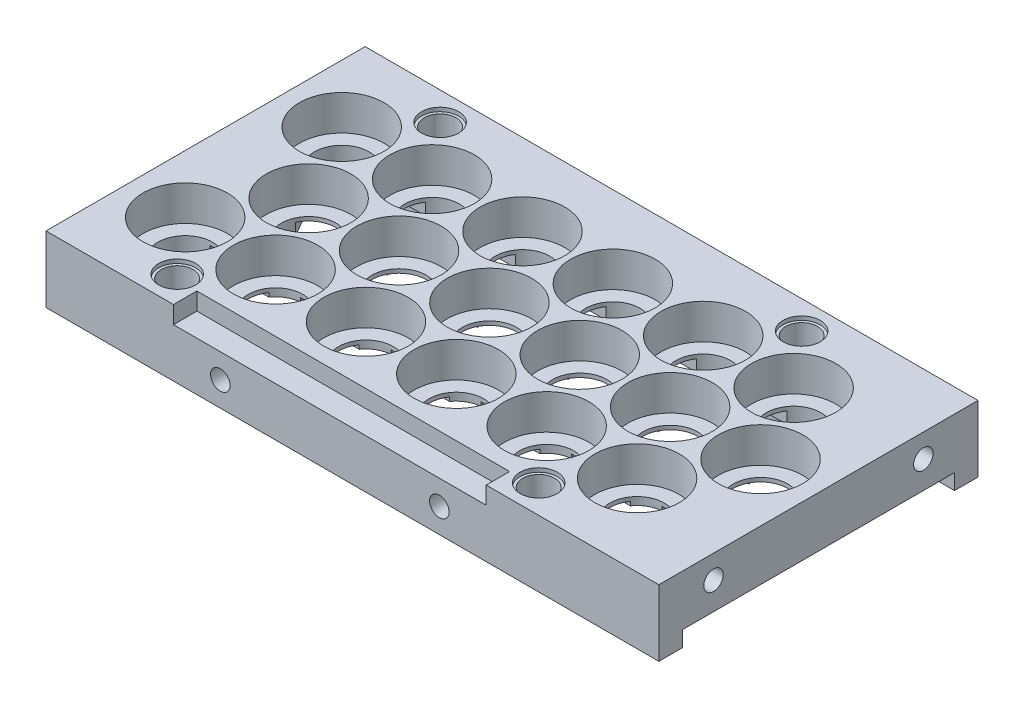
from build123d import *
from build123d.topology import SkipClean

# Parameters (mm, degrees)
SKETCH1_W            = 156.975
SKETCH1_H            = 81.746976195
SKETCH1_R            = 10.825
BOSS_EXTRUDE2_DEPTH  = 11
SKETCH1_3_R          = 10.825
SKETCH1_3_R_2        = 7
BOSS_EXTRUDE3_DEPTH  = 2
CUT_EXTRUDE1_DEPTH   = 1
CUT_EXTRUDE3_REACH   = 157.046
SKETCH9_R            = 4.0767
SKETCH10_R           = 4.7625
CUT_EXTRUDE4_DEPTH   = 1
SKETCH13_R           = 6.5
BOSS_EXTRUDE7_DEPTH  = 6
BOSS_EXTRUDE9_START  = 2
BOSS_EXTRUDE9_DEPTH  = 2
BOSS_EXTRUDE10_DEPTH = 2
SKETCH17_R           = 2.5
CUT_EXTRUDE5_DEPTH   = 4
SKETCH19_W           = 80.1
SKETCH19_H           = 4.475
CUT_EXTRUDE6_DEPTH   = 6
SKETCH20_R           = 2.5
CUT_EXTRUDE7_DEPTH   = 5
SKETCH22_R           = 2.5
CUT_EXTRUDE8_DEPTH   = 10


with BuildPart() as part:
    # Sketch1 → Boss-Extrude2 (new body)
    with BuildSketch(Plane(origin=(0, 0, 0), x_dir=(1, 0, 0), z_dir=(0, 1, 0))):
        with Locations((63.6625, -20.048488098)):
            Rectangle(SKETCH1_W, SKETCH1_H)
        with Locations((0, -40.096976195)):
            Circle(SKETCH1_R, mode=Mode.SUBTRACT)
        with Locations((23.15, -40.096976195)):
            Circle(SKETCH1_R, mode=Mode.SUBTRACT)
        with Locations((46.3, -40.096976195)):
            Circle(SKETCH1_R, mode=Mode.SUBTRACT)
        with Locations((69.45, -40.096976195)):
            Circle(SKETCH1_R, mode=Mode.SUBTRACT)
        with Locations((92.6, -40.096976195)):
            Circle(SKETCH1_R, mode=Mode.SUBTRACT)
        with Locations((115.75, -40.096976195)):
            Circle(SKETCH1_R, mode=Mode.SUBTRACT)
        with Locations((11.575, -20.048488098)):
            Circle(SKETCH1_R, mode=Mode.SUBTRACT)
        Circle(SKETCH1_R, mode=Mode.SUBTRACT)
        with Locations((23.15, 0)):
            Circle(SKETCH1_R, mode=Mode.SUBTRACT)
        with Locations((34.725, -20.048488098)):
            Circle(SKETCH1_R, mode=Mode.SUBTRACT)
        with Locations((57.875, -20.048488098)):
            Circle(SKETCH1_R, mode=Mode.SUBTRACT)
        with Locations((46.3, 0)):
            Circle(SKETCH1_R, mode=Mode.SUBTRACT)
        with Locations((81.025, -20.048488098)):
            Circle(SKETCH1_R, mode=Mode.SUBTRACT)
        with Locations((69.45, 0)):
            Circle(SKETCH1_R, mode=Mode.SUBTRACT)
        with Locations((92.6, 0)):
            Circle(SKETCH1_R, mode=Mode.SUBTRACT)
        with Locations((104.175, -20.048488098)):
            Circle(SKETCH1_R, mode=Mode.SUBTRACT)
        with Locations((127.325, -20.048488098)):
            Circle(SKETCH1_R, mode=Mode.SUBTRACT)
        with Locations((115.75, 0)):
            Circle(SKETCH1_R, mode=Mode.SUBTRACT)
    extrude(amount=BOSS_EXTRUDE2_DEPTH)

    # Sketch1<3> → Boss-Extrude3 (add)
    # profile 1 of 18: a face of its own
    with BuildSketch(Plane(origin=(0, 0, 0), x_dir=(1, 0, 0), z_dir=(0, 1, 0))):
        Circle(SKETCH1_3_R)
        Circle(SKETCH1_3_R_2, mode=Mode.SUBTRACT)
    # profile 2 of 18: a face of its own
    with BuildSketch(Plane(origin=(0, 0, 0), x_dir=(1, 0, 0), z_dir=(0, 1, 0))):
        with Locations((11.575, -20.048488098)):
            Circle(SKETCH1_3_R)
        with Locations((11.575, -20.048488098)):
            Circle(SKETCH1_3_R_2, mode=Mode.SUBTRACT)
    # profile 3 of 18: a face of its own
    with BuildSketch(Plane(origin=(0, 0, 0), x_dir=(1, 0, 0), z_dir=(0, 1, 0))):
        with Locations((0, -40.096976195)):
            Circle(SKETCH1_3_R)
        with Locations((0, -40.096976195)):
            Circle(SKETCH1_3_R_2, mode=Mode.SUBTRACT)
    # profile 4 of 18: a face of its own
    with BuildSketch(Plane(origin=(0, 0, 0), x_dir=(1, 0, 0), z_dir=(0, 1, 0))):
        with Locations((23.15, 0)):
            Circle(SKETCH1_3_R)
        with Locations((23.15, 0)):
            Circle(SKETCH1_3_R_2, mode=Mode.SUBTRACT)
    # profile 5 of 18: a face of its own
    with BuildSketch(Plane(origin=(0, 0, 0), x_dir=(1, 0, 0), z_dir=(0, 1, 0))):
        with Locations((34.725, -20.048488098)):
            Circle(SKETCH1_3_R)
        with Locations((34.725, -20.048488098)):
            Circle(SKETCH1_3_R_2, mode=Mode.SUBTRACT)
    # profile 6 of 18: a face of its own
    with BuildSketch(Plane(origin=(0, 0, 0), x_dir=(1, 0, 0), z_dir=(0, 1, 0))):
        with Locations((23.15, -40.096976195)):
            Circle(SKETCH1_3_R)
        with Locations((23.15, -40.096976195)):
            Circle(SKETCH1_3_R_2, mode=Mode.SUBTRACT)
    # profile 7 of 18: a face of its own
    with BuildSketch(Plane(origin=(0, 0, 0), x_dir=(1, 0, 0), z_dir=(0, 1, 0))):
        with Locations((46.3, 0)):
            Circle(SKETCH1_3_R)
        with Locations((46.3, 0)):
            Circle(SKETCH1_3_R_2, mode=Mode.SUBTRACT)
    # profile 8 of 18: a face of its own
    with BuildSketch(Plane(origin=(0, 0, 0), x_dir=(1, 0, 0), z_dir=(0, 1, 0))):
        with Locations((57.875, -20.048488098)):
            Circle(SKETCH1_3_R)
        with Locations((57.875, -20.048488098)):
            Circle(SKETCH1_3_R_2, mode=Mode.SUBTRACT)
    # profile 9 of 18: a face of its own
    with BuildSketch(Plane(origin=(0, 0, 0), x_dir=(1, 0, 0), z_dir=(0, 1, 0))):
        with Locations((46.3, -40.096976195)):
            Circle(SKETCH1_3_R)
        with Locations((46.3, -40.096976195)):
            Circle(SKETCH1_3_R_2, mode=Mode.SUBTRACT)
    # profile 10 of 18: a face of its own
    with BuildSketch(Plane(origin=(0, 0, 0), x_dir=(1, 0, 0), z_dir=(0, 1, 0))):
        with Locations((69.45, 0)):
            Circle(SKETCH1_3_R)
        with Locations((69.45, 0)):
            Circle(SKETCH1_3_R_2, mode=Mode.SUBTRACT)
    # profile 11 of 18: a face of its own
    with BuildSketch(Plane(origin=(0, 0, 0), x_dir=(1, 0, 0), z_dir=(0, 1, 0))):
        with Locations((81.025, -20.048488098)):
            Circle(SKETCH1_3_R)
        with Locations((81.025, -20.048488098)):
            Circle(SKETCH1_3_R_2, mode=Mode.SUBTRACT)
    # profile 12 of 18: a face of its own
    with BuildSketch(Plane(origin=(0, 0, 0), x_dir=(1, 0, 0), z_dir=(0, 1, 0))):
        with Locations((69.45, -40.096976195)):
            Circle(SKETCH1_3_R)
        with Locations((69.45, -40.096976195)):
            Circle(SKETCH1_3_R_2, mode=Mode.SUBTRACT)
    # profile 13 of 18: a face of its own
    with BuildSketch(Plane(origin=(0, 0, 0), x_dir=(1, 0, 0), z_dir=(0, 1, 0))):
        with Locations((92.6, 0)):
            Circle(SKETCH1_3_R)
        with Locations((92.6, 0)):
            Circle(SKETCH1_3_R_2, mode=Mode.SUBTRACT)
    # profile 14 of 18: a face of its own
    with BuildSketch(Plane(origin=(0, 0, 0), x_dir=(1, 0, 0), z_dir=(0, 1, 0))):
        with Locations((104.175, -20.048488098)):
            Circle(SKETCH1_3_R)
        with Locations((104.175, -20.048488098)):
            Circle(SKETCH1_3_R_2, mode=Mode.SUBTRACT)
    # profile 15 of 18: a face of its own
    with BuildSketch(Plane(origin=(0, 0, 0), x_dir=(1, 0, 0), z_dir=(0, 1, 0))):
        with Locations((92.6, -40.096976195)):
            Circle(SKETCH1_3_R)
        with Locations((92.6, -40.096976195)):
            Circle(SKETCH1_3_R_2, mode=Mode.SUBTRACT)
    # profile 16 of 18: a face of its own
    with BuildSketch(Plane(origin=(0, 0, 0), x_dir=(1, 0, 0), z_dir=(0, 1, 0))):
        with Locations((115.75, 0)):
            Circle(SKETCH1_3_R)
        with Locations((115.75, 0)):
            Circle(SKETCH1_3_R_2, mode=Mode.SUBTRACT)
    # profile 17 of 18: a face of its own
    with BuildSketch(Plane(origin=(0, 0, 0), x_dir=(1, 0, 0), z_dir=(0, 1, 0))):
        with Locations((127.325, -20.048488098)):
            Circle(SKETCH1_3_R)
        with Locations((127.325, -20.048488098)):
            Circle(SKETCH1_3_R_2, mode=Mode.SUBTRACT)
    # profile 18 of 18: a face of its own
    with BuildSketch(Plane(origin=(0, 0, 0), x_dir=(1, 0, 0), z_dir=(0, 1, 0))):
        with Locations((115.75, -40.096976195)):
            Circle(SKETCH1_3_R)
        with Locations((115.75, -40.096976195)):
            Circle(SKETCH1_3_R_2, mode=Mode.SUBTRACT)
    extrude(amount=BOSS_EXTRUDE3_DEPTH)

    # Sketch2 → Cut-Extrude1 (cut)
    with BuildSketch(Plane.XZ):
        with BuildLine():
            Line((-0.591820292, 33.12203901), (5.238617062, 23.023425283))
            ThreePointArc((5.238617062, 23.023425283), (8.075, 26.110665924), (12.166820292, 27.023425283))
            Line((12.166820292, 27.023425283), (6.92820323, 36.096976195))
            Line((6.92820323, 36.096976195), (17.405437353, 36.096976195))
            ThreePointArc((17.405437353, 36.096976195), (16.15, 40.096976195), (17.405437353, 44.096976195))
            Line((17.405437353, 44.096976195), (5.744562647, 44.096976195))
            ThreePointArc((5.744562647, 44.096976195), (6.062177826, 36.596976195), (-0.591820292, 33.12203901))
        make_face()
        with BuildLine():
            Line((27.79679677, 24.048488098), (17.319562647, 24.048488098))
            ThreePointArc((17.319562647, 24.048488098), (18.575, 20.048488098), (17.319562647, 16.048488098))
            Line((17.319562647, 16.048488098), (27.79679677, 16.048488098))
            Line((27.79679677, 16.048488098), (22.558179708, 6.974937186))
            ThreePointArc((22.558179708, 6.974937186), (26.124937186, 6.336382938), (28.894562647, 4))
            Line((28.894562647, 4), (6.92820323, 4))
            Line((6.92820323, 4), (12.166820292, 13.073550912))
            ThreePointArc((12.166820292, 13.073550912), (8.075, 13.986310271), (5.238617062, 17.073550912))
            Line((5.238617062, 17.073550912), (-0.591820292, 6.974937186))
            ThreePointArc((-0.591820292, 6.974937186), (2.974937186, 6.336382938), (5.744562647, 4))
            Line((5.744562647, 4), (0, 4))
            ThreePointArc((0, 4), (-4, 0), (0, -4))
            Line((0, -4), (115.75, -4))
            ThreePointArc((115.75, -4), (119.75, 0), (115.75, 4))
            Line((115.75, 4), (99.52820323, 4))
            Line((99.52820323, 4), (104.766820292, 13.073550912))
            ThreePointArc((104.766820292, 13.073550912), (97.175, 20.048488098), (104.766820292, 27.023425283))
            Line((104.766820292, 27.023425283), (99.52820323, 36.096976195))
            Line((99.52820323, 36.096976195), (110.005437353, 36.096976195))
            ThreePointArc((110.005437353, 36.096976195), (108.75, 40.096976195), (110.005437353, 44.096976195))
            Line((110.005437353, 44.096976195), (98.344562647, 44.096976195))
            ThreePointArc((98.344562647, 44.096976195), (98.662177826, 36.596976195), (92.008179708, 33.12203901))
            Line((92.008179708, 33.12203901), (97.24679677, 24.048488098))
            Line((97.24679677, 24.048488098), (86.769562647, 24.048488098))
            ThreePointArc((86.769562647, 24.048488098), (88.025, 20.048488098), (86.769562647, 16.048488098))
            Line((86.769562647, 16.048488098), (97.24679677, 16.048488098))
            Line((97.24679677, 16.048488098), (92.008179708, 6.974937186))
            ThreePointArc((92.008179708, 6.974937186), (95.574937186, 6.336382938), (98.344562647, 4))
            Line((98.344562647, 4), (76.37820323, 4))
            Line((76.37820323, 4), (81.616820292, 13.073550912))
            ThreePointArc((81.616820292, 13.073550912), (74.025, 20.048488098), (81.616820292, 27.023425283))
            Line((81.616820292, 27.023425283), (76.37820323, 36.096976195))
            Line((76.37820323, 36.096976195), (86.855437353, 36.096976195))
            ThreePointArc((86.855437353, 36.096976195), (85.6, 40.096976195), (86.855437353, 44.096976195))
            Line((86.855437353, 44.096976195), (75.194562647, 44.096976195))
            ThreePointArc((75.194562647, 44.096976195), (75.512177826, 36.596976195), (68.858179708, 33.12203901))
            Line((68.858179708, 33.12203901), (74.09679677, 24.048488098))
            Line((74.09679677, 24.048488098), (63.619562647, 24.048488098))
            ThreePointArc((63.619562647, 24.048488098), (64.875, 20.048488098), (63.619562647, 16.048488098))
            Line((63.619562647, 16.048488098), (74.09679677, 16.048488098))
            Line((74.09679677, 16.048488098), (68.858179708, 6.974937186))
            ThreePointArc((68.858179708, 6.974937186), (72.424937186, 6.336382938), (75.194562647, 4))
            Line((75.194562647, 4), (53.22820323, 4))
            Line((53.22820323, 4), (58.466820292, 13.073550912))
            ThreePointArc((58.466820292, 13.073550912), (50.875, 20.048488098), (58.466820292, 27.023425283))
            Line((58.466820292, 27.023425283), (53.22820323, 36.096976195))
            Line((53.22820323, 36.096976195), (63.705437353, 36.096976195))
            ThreePointArc((63.705437353, 36.096976195), (62.45, 40.096976195), (63.705437353, 44.096976195))
            Line((63.705437353, 44.096976195), (52.044562647, 44.096976195))
            ThreePointArc((52.044562647, 44.096976195), (52.362177826, 36.596976195), (45.708179708, 33.12203901))
            Line((45.708179708, 33.12203901), (50.94679677, 24.048488098))
            Line((50.94679677, 24.048488098), (40.469562647, 24.048488098))
            ThreePointArc((40.469562647, 24.048488098), (41.725, 20.048488098), (40.469562647, 16.048488098))
            Line((40.469562647, 16.048488098), (50.94679677, 16.048488098))
            Line((50.94679677, 16.048488098), (45.708179708, 6.974937186))
            ThreePointArc((45.708179708, 6.974937186), (49.274937186, 6.336382938), (52.044562647, 4))
            Line((52.044562647, 4), (30.07820323, 4))
            Line((30.07820323, 4), (35.316820292, 13.073550912))
            ThreePointArc((35.316820292, 13.073550912), (27.725, 20.048488098), (35.316820292, 27.023425283))
            Line((35.316820292, 27.023425283), (30.07820323, 36.096976195))
            Line((30.07820323, 36.096976195), (40.555437353, 36.096976195))
            ThreePointArc((40.555437353, 36.096976195), (39.3, 40.096976195), (40.555437353, 44.096976195))
            Line((40.555437353, 44.096976195), (28.894562647, 44.096976195))
            ThreePointArc((28.894562647, 44.096976195), (29.212177826, 36.596976195), (22.558179708, 33.12203901))
            Line((22.558179708, 33.12203901), (27.79679677, 24.048488098))
        make_face()
        with BuildLine():
            Line((127.916820292, 27.023425283), (122.086382938, 37.12203901))
            ThreePointArc((122.086382938, 37.12203901), (119.25, 34.034798369), (115.158179708, 33.12203901))
            Line((115.158179708, 33.12203901), (120.39679677, 24.048488098))
            Line((120.39679677, 24.048488098), (109.919562647, 24.048488098))
            ThreePointArc((109.919562647, 24.048488098), (111.175, 20.048488098), (109.919562647, 16.048488098))
            Line((109.919562647, 16.048488098), (120.39679677, 16.048488098))
            Line((120.39679677, 16.048488098), (115.158179708, 6.974937186))
            ThreePointArc((115.158179708, 6.974937186), (119.25, 6.062177826), (122.086382938, 2.974937186))
            Line((122.086382938, 2.974937186), (127.916820292, 13.073550912))
            ThreePointArc((127.916820292, 13.073550912), (120.325, 20.048488098), (127.916820292, 27.023425283))
        make_face()
    extrude(amount=-CUT_EXTRUDE1_DEPTH, mode=Mode.SUBTRACT)

    # Sketch9 → Cut-Extrude3 (cut, up to next)
    with BuildSketch(Plane(origin=(0, 11, 0), x_dir=(1, 0, 0), z_dir=(0, 1, 0)), mode=Mode.PRIVATE) as cut_extrude3_sk1:
        with Locations((11.575, 13.625)):
            Circle(SKETCH9_R)
    cut_extrude3_tool1 = extrude(cut_extrude3_sk1.sketch, amount=-CUT_EXTRUDE3_REACH, mode=Mode.PRIVATE) & part.part
    # Sketch9 → Cut-Extrude3 (cut, up to next)
    with BuildSketch(Plane(origin=(0, 11, 0), x_dir=(1, 0, 0), z_dir=(0, 1, 0)), mode=Mode.PRIVATE) as cut_extrude3_sk2:
        with Locations((11.575, -53.721976195)):
            Circle(SKETCH9_R)
    cut_extrude3_tool2 = extrude(cut_extrude3_sk2.sketch, amount=-CUT_EXTRUDE3_REACH, mode=Mode.PRIVATE) & part.part
    # Sketch9 → Cut-Extrude3 (cut, up to next)
    with BuildSketch(Plane(origin=(0, 11, 0), x_dir=(1, 0, 0), z_dir=(0, 1, 0)), mode=Mode.PRIVATE) as cut_extrude3_sk3:
        with Locations((104.175, -53.721976195)):
            Circle(SKETCH9_R)
    cut_extrude3_tool3 = extrude(cut_extrude3_sk3.sketch, amount=-CUT_EXTRUDE3_REACH, mode=Mode.PRIVATE) & part.part
    # Sketch9 → Cut-Extrude3 (cut, up to next)
    with BuildSketch(Plane(origin=(0, 11, 0), x_dir=(1, 0, 0), z_dir=(0, 1, 0)), mode=Mode.PRIVATE) as cut_extrude3_sk4:
        with Locations((104.175, 13.625)):
            Circle(SKETCH9_R)
    cut_extrude3_tool4 = extrude(cut_extrude3_sk4.sketch, amount=-CUT_EXTRUDE3_REACH, mode=Mode.PRIVATE) & part.part
    add(cut_extrude3_tool1.solids().sort_by_distance((11.575, 11, -13.625))[0], mode=Mode.SUBTRACT)
    add(cut_extrude3_tool2.solids().sort_by_distance((11.575, 11, 53.721976))[0], mode=Mode.SUBTRACT)
    add(cut_extrude3_tool3.solids().sort_by_distance((104.175, 11, 53.721976))[0], mode=Mode.SUBTRACT)
    add(cut_extrude3_tool4.solids().sort_by_distance((104.175, 11, -13.625))[0], mode=Mode.SUBTRACT)

    # Sketch10 → Cut-Extrude4 (cut)
    with BuildSketch(Plane(origin=(0, 11, 0), x_dir=(1, 0, 0), z_dir=(0, 1, 0))):
        with Locations((11.575, 13.625)):
            Circle(SKETCH10_R)
        with Locations((104.175, 13.625)):
            Circle(SKETCH10_R)
        with Locations((104.175, -53.721976195)):
            Circle(SKETCH10_R)
        with Locations((11.575, -53.721976195)):
            Circle(SKETCH10_R)
    extrude(amount=-CUT_EXTRUDE4_DEPTH, mode=Mode.SUBTRACT)

    # Sketch13 → Boss-Extrude7 (add)
    # profile 1 of 2: a face of its own
    with BuildSketch(Plane.XZ):
        with BuildLine():
            ThreePointArc((3.665512027, 54.921976195), (11.575, 45.721976195), (19.484487973, 54.921976195))
            Line((19.484487973, 54.921976195), (96.265512027, 54.921976195))
            ThreePointArc((96.265512027, 54.921976195), (104.175, 45.721976195), (112.084487973, 54.921976195))
            Line((112.084487973, 54.921976195), (142.15, 54.921976195))
            Line((142.15, 54.921976195), (142.15, 60.921976195))
            Line((142.15, 60.921976195), (-14.825, 60.921976195))
            Line((-14.825, 60.921976195), (-14.825, 54.921976195))
            Line((-14.825, 54.921976195), (3.665512027, 54.921976195))
        make_face()
        with Locations((11.575, 53.721976195)):
            Circle(SKETCH13_R, mode=Mode.SUBTRACT)
        with Locations((104.175, 53.721976195)):
            Circle(SKETCH13_R, mode=Mode.SUBTRACT)
    # profile 2 of 2: a face of its own
    with BuildSketch(Plane.XZ):
        with BuildLine():
            Line((-14.825, -14.825), (-14.825, -20.825))
            Line((-14.825, -20.825), (142.15, -20.825))
            Line((142.15, -20.825), (142.15, -14.825))
            Line((142.15, -14.825), (112.084487973, -14.825))
            ThreePointArc((112.084487973, -14.825), (104.175, -5.625), (96.265512027, -14.825))
            Line((96.265512027, -14.825), (19.484487973, -14.825))
            ThreePointArc((19.484487973, -14.825), (11.575, -5.625), (3.665512027, -14.825))
            Line((3.665512027, -14.825), (-14.825, -14.825))
        make_face()
        with Locations((11.575, -13.625)):
            Circle(SKETCH13_R, mode=Mode.SUBTRACT)
        with Locations((104.175, -13.625)):
            Circle(SKETCH13_R, mode=Mode.SUBTRACT)
    extrude(amount=BOSS_EXTRUDE7_DEPTH)

    # Sketch14 → Boss-Extrude9 (add)
    with SkipClean():  # the faces are left unmerged after this step: merging them gives an invalid solid
        with BuildSketch(Plane.XZ.offset(BOSS_EXTRUDE9_START)):
            with BuildLine():
                Line((142.15, 54.921976195), (142.15, -14.825))
                Line((142.15, -14.825), (112.084487973, -14.825))
                ThreePointArc((112.084487973, -14.825), (104.175, -5.625), (96.265512027, -14.825))
                Line((96.265512027, -14.825), (19.484487973, -14.825))
                ThreePointArc((19.484487973, -14.825), (11.575, -5.625), (3.665512027, -14.825))
                Line((3.665512027, -14.825), (-14.825, -14.825))
                Line((-14.825, -14.825), (-14.825, 54.921976195))
                Line((-14.825, 54.921976195), (3.665512027, 54.921976195))
                ThreePointArc((3.665512027, 54.921976195), (11.575, 45.721976195), (19.484487973, 54.921976195))
                Line((19.484487973, 54.921976195), (96.265512027, 54.921976195))
                ThreePointArc((96.265512027, 54.921976195), (104.175, 45.721976195), (112.084487973, 54.921976195))
                Line((112.084487973, 54.921976195), (142.15, 54.921976195))
            make_face()
            with BuildLine():
                Line((5.238617062, 17.073550912), (-0.591820292, 6.974937186))
                ThreePointArc((-0.591820292, 6.974937186), (-6.062177826, -3.5), (5.744562647, -4))
                Line((5.744562647, -4), (17.405437353, -4))
                ThreePointArc((17.405437353, -4), (23.15, -7), (28.894562647, -4))
                Line((28.894562647, -4), (40.555437353, -4))
                ThreePointArc((40.555437353, -4), (46.3, -7), (52.044562647, -4))
                Line((52.044562647, -4), (63.705437353, -4))
                ThreePointArc((63.705437353, -4), (69.45, -7), (75.194562647, -4))
                Line((75.194562647, -4), (86.855437353, -4))
                ThreePointArc((86.855437353, -4), (92.6, -7), (98.344562647, -4))
                Line((98.344562647, -4), (110.005437353, -4))
                ThreePointArc((110.005437353, -4), (119.25, -6.062177826), (122.086382938, 2.974937186))
                Line((122.086382938, 2.974937186), (127.916820292, 13.073550912))
                ThreePointArc((127.916820292, 13.073550912), (134.325, 20.048488098), (127.916820292, 27.023425283))
                Line((127.916820292, 27.023425283), (122.086382938, 37.12203901))
                ThreePointArc((122.086382938, 37.12203901), (119.25, 46.159154022), (110.005437353, 44.096976195))
                Line((110.005437353, 44.096976195), (98.344562647, 44.096976195))
                ThreePointArc((98.344562647, 44.096976195), (92.6, 47.096976195), (86.855437353, 44.096976195))
                Line((86.855437353, 44.096976195), (75.194562647, 44.096976195))
                ThreePointArc((75.194562647, 44.096976195), (69.45, 47.096976195), (63.705437353, 44.096976195))
                Line((63.705437353, 44.096976195), (52.044562647, 44.096976195))
                ThreePointArc((52.044562647, 44.096976195), (46.3, 47.096976195), (40.555437353, 44.096976195))
                Line((40.555437353, 44.096976195), (28.894562647, 44.096976195))
                ThreePointArc((28.894562647, 44.096976195), (23.15, 47.096976195), (17.405437353, 44.096976195))
                Line((17.405437353, 44.096976195), (5.744562647, 44.096976195))
                ThreePointArc((5.744562647, 44.096976195), (-6.062177826, 43.596976195), (-0.591820292, 33.12203901))
                Line((-0.591820292, 33.12203901), (5.238617062, 23.023425283))
                ThreePointArc((5.238617062, 23.023425283), (4.575, 20.048488098), (5.238617062, 17.073550912))
            make_face(mode=Mode.SUBTRACT)
        extrude(amount=-BOSS_EXTRUDE9_DEPTH)

    # Sketch16 → Boss-Extrude10 (add)
    with SkipClean():  # the faces are left unmerged after this step: merging them gives an invalid solid
        with BuildSketch(Plane.XZ):
            with BuildLine():
                Line((15.536128823, 32.859238845), (20.688871177, 29.884301659))
                ThreePointArc((20.688871177, 29.884301659), (21.237909283, 27.835263554), (19.188871177, 27.286225448))
                Line((19.188871177, 27.286225448), (14.036128823, 30.261162634))
                ThreePointArc((14.036128823, 30.261162634), (13.487090717, 32.310200739), (15.536128823, 32.859238845))
            make_face()
            with BuildLine():
                Line((38.686128823, 32.859238845), (43.838871177, 29.884301659))
                ThreePointArc((43.838871177, 29.884301659), (44.387909283, 27.835263554), (42.338871177, 27.286225448))
                Line((42.338871177, 27.286225448), (37.186128823, 30.261162634))
                ThreePointArc((37.186128823, 30.261162634), (36.637090717, 32.310200739), (38.686128823, 32.859238845))
            make_face()
            with BuildLine():
                Line((61.836128823, 32.859238845), (66.988871177, 29.884301659))
                ThreePointArc((66.988871177, 29.884301659), (67.537909283, 27.835263554), (65.488871177, 27.286225448))
                Line((65.488871177, 27.286225448), (60.336128823, 30.261162634))
                ThreePointArc((60.336128823, 30.261162634), (59.787090717, 32.310200739), (61.836128823, 32.859238845))
            make_face()
            with BuildLine():
                Line((84.986128823, 32.859238845), (90.138871177, 29.884301659))
                ThreePointArc((90.138871177, 29.884301659), (90.687909283, 27.835263554), (88.638871177, 27.286225448))
                Line((88.638871177, 27.286225448), (83.486128823, 30.261162634))
                ThreePointArc((83.486128823, 30.261162634), (82.937090717, 32.310200739), (84.986128823, 32.859238845))
            make_face()
            with BuildLine():
                Line((108.136128823, 32.859238845), (113.288871177, 29.884301659))
                ThreePointArc((113.288871177, 29.884301659), (113.837909283, 27.835263554), (111.788871177, 27.286225448))
                Line((111.788871177, 27.286225448), (106.636128823, 30.261162634))
                ThreePointArc((106.636128823, 30.261162634), (106.087090717, 32.310200739), (108.136128823, 32.859238845))
            make_face()
            with BuildLine():
                Line((15.536128823, 7.23773735), (20.688871177, 10.212674536))
                ThreePointArc((20.688871177, 10.212674536), (21.237909283, 12.261712642), (19.188871177, 12.810750747))
                Line((19.188871177, 12.810750747), (14.036128823, 9.835813562))
                ThreePointArc((14.036128823, 9.835813562), (13.487090717, 7.786775456), (15.536128823, 7.23773735))
            make_face()
            with BuildLine():
                Line((38.686128823, 7.23773735), (43.838871177, 10.212674536))
                ThreePointArc((43.838871177, 10.212674536), (44.387909283, 12.261712642), (42.338871177, 12.810750747))
                Line((42.338871177, 12.810750747), (37.186128823, 9.835813562))
                ThreePointArc((37.186128823, 9.835813562), (36.637090717, 7.786775456), (38.686128823, 7.23773735))
            make_face()
            with BuildLine():
                Line((61.836128823, 7.23773735), (66.988871177, 10.212674536))
                ThreePointArc((66.988871177, 10.212674536), (67.537909283, 12.261712642), (65.488871177, 12.810750747))
                Line((65.488871177, 12.810750747), (60.336128823, 9.835813562))
                ThreePointArc((60.336128823, 9.835813562), (59.787090717, 7.786775456), (61.836128823, 7.23773735))
            make_face()
            with BuildLine():
                Line((84.986128823, 7.23773735), (90.138871177, 10.212674536))
                ThreePointArc((90.138871177, 10.212674536), (90.687909283, 12.261712642), (88.638871177, 12.810750747))
                Line((88.638871177, 12.810750747), (83.486128823, 9.835813562))
                ThreePointArc((83.486128823, 9.835813562), (82.937090717, 7.786775456), (84.986128823, 7.23773735))
            make_face()
            with BuildLine():
                Line((108.136128823, 7.23773735), (113.288871177, 10.212674536))
                ThreePointArc((113.288871177, 10.212674536), (113.837909283, 12.261712642), (111.788871177, 12.810750747))
                Line((111.788871177, 12.810750747), (106.636128823, 9.835813562))
                ThreePointArc((106.636128823, 9.835813562), (106.087090717, 7.786775456), (108.136128823, 7.23773735))
            make_face()
        extrude(amount=BOSS_EXTRUDE10_DEPTH)

    # Sketch17 → Cut-Extrude5 (cut)
    with BuildSketch(Plane(origin=(0, -2, 0), x_dir=(-1, 0, 0), z_dir=(0, -1, 0))):
        with Locations((10.825, -49.509476195)):
            Circle(SKETCH17_R)
        with Locations((-57.875, -49.509476195)):
            Circle(SKETCH17_R)
        with Locations((-132.15, -49.509476195)):
            Circle(SKETCH17_R)
        with Locations((-132.15, 9.4125)):
            Circle(SKETCH17_R)
        with Locations((-57.875, 9.4125)):
            Circle(SKETCH17_R)
        with Locations((10.825, 9.4125)):
            Circle(SKETCH17_R)
    extrude(amount=-CUT_EXTRUDE5_DEPTH, mode=Mode.SUBTRACT)

    # Sketch19 → Cut-Extrude6 (cut)
    with BuildSketch(Plane.XY.offset(60.921976195)):
        with Locations((57.875, 8.7625)):
            Rectangle(SKETCH19_W, SKETCH19_H)
    extrude(amount=-CUT_EXTRUDE6_DEPTH, mode=Mode.SUBTRACT)

    # Sketch20 → Cut-Extrude7 (cut)
    with BuildSketch(Plane.XY.offset(60.921976195)):
        with Locations((29.825, 0.2625)):
            Circle(SKETCH20_R)
        with Locations((85.925, 0.2625)):
            Circle(SKETCH20_R)
    extrude(amount=-CUT_EXTRUDE7_DEPTH, mode=Mode.SUBTRACT)

    # Sketch22 → Cut-Extrude8 (cut)
    with BuildSketch(Plane(origin=(142.15, 0, 0), x_dir=(0, 0, -1), z_dir=(1, 0, 0))):
        with Locations((-46.921976195, 5)):
            Circle(SKETCH22_R)
        with Locations((6.825, 5)):
            Circle(SKETCH22_R)
    extrude(amount=-CUT_EXTRUDE8_DEPTH, mode=Mode.SUBTRACT)


solid = part.part
